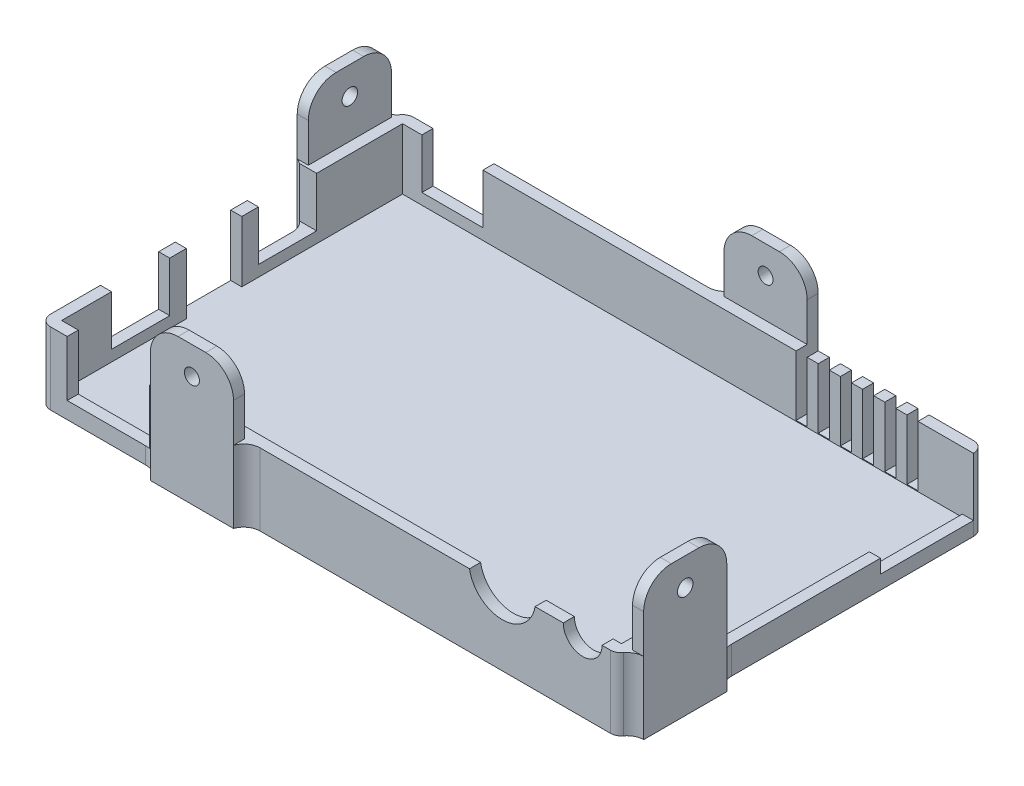
from build123d import *

# Parameters (mm, degrees)
SKETCH_1_W          = 105
SKETCH_1_H          = 65.5
EXTRUDE_1_DEPTH     = 13
SHELL_1_T           = -2
SKETCH_2_R          = 3.5
SKETCH_2_R_2        = 6
SKETCH_2_W          = 15
SKETCH_2_H          = 10
CUT_EXTRUDE_1_DEPTH = 15
SKETCH_3_W          = 10.5
SKETCH_3_H          = 9
SKETCH_3_W_2        = 10
SKETCH_3_H_2        = 11
CUT_EXTRUDE_2_DEPTH = 15
CUT_EXTRUDE_3_DEPTH = 15
FILLET_1_R          = 2
SKETCH_5_W          = 2
SKETCH_5_H          = 17.199999525
CUT_EXTRUDE_4_DEPTH = 15
SKETCH_6_W          = 11
SKETCH_6_H          = 9
CUT_EXTRUDE_5_DEPTH = 15
SKETCH_10_W         = 2
SKETCH_10_H         = 15
SKETCH_10_W_2       = 15
SKETCH_10_H_2       = 2
EXTRUDE_2_DEPTH     = 25
FILLET_2_R          = 3
FILLET_3_R          = 5
SKETCH_11_R         = 1.4
CUT_EXTRUDE_6_DEPTH = 120
SKETCH_13_R         = 1.35
CUT_EXTRUDE_7_DEPTH = 76


with BuildPart() as part:
    # 草图1 → 凸台-拉伸1 (new body)
    with BuildSketch(Plane(origin=(0, 0, 0), x_dir=(1, 0, 0), z_dir=(0, 1, 0))):
        with Locations((0, 0.25)):
            Rectangle(SKETCH_1_W, SKETCH_1_H)
    extrude(amount=EXTRUDE_1_DEPTH)

    # 抽壳1
    shell_1_openings = [part.faces().sort_by_distance(p)[0] for p in [
        (0, 13, -0.25),
    ]]
    offset(amount=SHELL_1_T, openings=shell_1_openings, kind=Kind.INTERSECTION)

    # 草图2 → 切除-拉伸1 (cut)
    with BuildSketch(Plane.XY.offset(32.5)):
        with Locations((45.5, 13)):
            Circle(SKETCH_2_R)
        with Locations((31, 14)):
            Circle(SKETCH_2_R_2)
        with Locations((-40, 8)):
            Rectangle(SKETCH_2_W, SKETCH_2_H)
    extrude(amount=-CUT_EXTRUDE_1_DEPTH, mode=Mode.SUBTRACT)

    # 草图3 → 切除-拉伸2 (cut)
    with BuildSketch(Plane.ZY.offset(52.5)):
        with Locations((16.25, 8.5)):
            Rectangle(SKETCH_3_W, SKETCH_3_H)
        with Locations((-10.25, 8.5)):
            Rectangle(SKETCH_3_W, SKETCH_3_H)
        with Locations((3, 7.5)):
            Rectangle(SKETCH_3_W_2, SKETCH_3_H_2)
    extrude(amount=-CUT_EXTRUDE_2_DEPTH, mode=Mode.SUBTRACT)

    # 草图4 → 切除-拉伸3 (cut)
    with BuildSketch(Plane(origin=(52.5, 0, 0), x_dir=(0, 0, -1), z_dir=(1, 0, 0))):
        Polygon((31, 13), (14.225771641, 13), (12.965043457, 13), (-15.5, 13), (-15.5, 5), (12.965043457, 5), (14.225771641, 5), (14.225771641, 2.5), (31, 2.5), align=None)
    extrude(amount=-CUT_EXTRUDE_3_DEPTH, mode=Mode.SUBTRACT)

    # 圆角1
    fillet_1_edges = [part.edges().sort_by_distance(p)[0] for p in [
        (-52.5, 6.5, -33),
        (52.5, 6.5, -33),
        (52.5, 6.5, 32.5),
        (-52.5, 6.5, 32.5),
    ]]
    fillet(fillet_1_edges, radius=FILLET_1_R)

    # 草图5 → 切除-拉伸4 (cut)
    with BuildSketch(Plane(origin=(0, 0, -33), x_dir=(-1, 0, 0), z_dir=(0, 0, -1))):
        with Locations((-41.5, 10.748878275)):
            Rectangle(SKETCH_5_W, SKETCH_5_H)
        with Locations((-37.5, 10.748878275)):
            Rectangle(SKETCH_5_W, SKETCH_5_H)
        with Locations((-33.5, 10.748878275)):
            Rectangle(SKETCH_5_W, SKETCH_5_H)
        with Locations((-29.5, 10.748878275)):
            Rectangle(SKETCH_5_W, SKETCH_5_H)
        with Locations((-25.5, 10.748878275)):
            Rectangle(SKETCH_5_W, SKETCH_5_H)
        with Locations((-21.5, 10.748878275)):
            Rectangle(SKETCH_5_W, SKETCH_5_H)
    extrude(amount=-CUT_EXTRUDE_4_DEPTH, mode=Mode.SUBTRACT)

    # 草图6 → 切除-拉伸5 (cut)
    with BuildSketch(Plane(origin=(0, 0, -33), x_dir=(-1, 0, 0), z_dir=(0, 0, -1))):
        with Locations((41.5, 8.5)):
            Rectangle(SKETCH_6_W, SKETCH_6_H)
    extrude(amount=-CUT_EXTRUDE_5_DEPTH, mode=Mode.SUBTRACT)

    # 草图10 → 凸台-拉伸2 (add)
    with BuildSketch(Plane.XZ):
        with Locations((-53.5, -23.5)):
            Rectangle(SKETCH_10_W, SKETCH_10_H)
        with Locations((53.5, 23)):
            Rectangle(SKETCH_10_W, SKETCH_10_H)
        with Locations((13, -34)):
            Rectangle(SKETCH_10_W_2, SKETCH_10_H_2)
        with Locations((-23, 33.5)):
            Rectangle(SKETCH_10_W_2, SKETCH_10_H_2)
    extrude(amount=-EXTRUDE_2_DEPTH)

    # 圆角2
    # the kernel refuses this fillet: 3 mm, written as the material it adds along each edge
    with BuildSketch(Plane(origin=(52.5, 0, 30.5), x_dir=(-0.31622776601639135, 0, 0.9486832980506626), z_dir=(0, 1, 0)), Plane(origin=(-52.5, 0, -31), x_dir=(0.31622776601639135, 0, -0.9486832980506626), z_dir=(0, 1, 0))) as fillet_2_piece_1:
        with BuildLine():
            CenterArc((2.213594362, 2.846049894), FILLET_2_R, 198.434948823, 53.130102354)
            Line((-0.632455532, 1.897366596), (0, 0))
            ThreePointArc((0, 0), (0.632455532, 0.102633404), (1.264911064, 0))
        make_face()
    extrude(amount=13)
    with BuildSketch(Plane(origin=(-52.5, 0, -16), x_dir=(0, 0, 1), z_dir=(0, 1, 0))) as fillet_2_piece_2_section:
        with BuildLine():
            CenterArc((2.828427125, -3), FILLET_2_R, 90, 70.528779366)
            Line((0, -2), (0, 0))
            Line((0, 0), (2.828427125, 0))
        make_face()
    fillet_2_piece_2 = extrude(amount=20.071067812, mode=Mode.PRIVATE)
    fillet_2_piece_2 = split(fillet_2_piece_2, bisect_by=Plane(origin=(-52.5, 4, -16), z_dir=(0, -1, 0)), keep=Keep.TOP, mode=Mode.PRIVATE)
    add(fillet_2_piece_2)
    with BuildSketch(Plane(origin=(-52.5, -7.071067812, -16), x_dir=(0, 0, 1), z_dir=(0, 1, 0))) as fillet_2_piece_3_section:
        with BuildLine():
            CenterArc((2.828427125, -3), FILLET_2_R, 90, 70.528779366)
            Line((0, -2), (0, 0))
            Line((0, 0), (2.828427125, 0))
        make_face()
    fillet_2_piece_3 = extrude(amount=20.071067812, mode=Mode.PRIVATE)
    fillet_2_piece_3 = split(fillet_2_piece_3, bisect_by=Plane(origin=(-52.5, -7.071067812, -15.5), z_dir=(0, 0, -1)), keep=Keep.TOP, mode=Mode.PRIVATE)
    fillet_2_piece_3 = split(fillet_2_piece_3, bisect_by=Plane(origin=(-52.5, 4, -16), z_dir=(0, 1, 0)), keep=Keep.TOP, mode=Mode.PRIVATE)
    add(fillet_2_piece_3)
    with BuildSketch(Plane(origin=(52.5, 0, 15.5), x_dir=(0, 0, -1), z_dir=(0, 1, 0))) as fillet_2_piece_4:
        with BuildLine():
            CenterArc((2.828427125, -3), FILLET_2_R, 90, 70.528779366)
            Line((0, -2), (0, 0))
            Line((0, 0), (2.828427125, 0))
        make_face()
    extrude(amount=5)
    with BuildSketch(Plane(origin=(5.5, 0, -33), x_dir=(-1, 0, 0), z_dir=(0, 1, 0)), Plane(origin=(-15.5, 0, 32.5), x_dir=(1, 0, 0), z_dir=(0, 1, 0))) as fillet_2_piece_5:
        with BuildLine():
            CenterArc((2.828427125, -3), FILLET_2_R, 90, 70.528779366)
            Line((0, -2), (0, 0))
            Line((0, 0), (2.828427125, 0))
        make_face()
    extrude(amount=13)
    with BuildSketch(Plane(origin=(-30.5, 0, 32.5), x_dir=(-1, 0, 0), z_dir=(0, 1, 0))) as fillet_2_piece_6_section:
        with BuildLine():
            CenterArc((2.828427125, 3), FILLET_2_R, 199.471220634, 70.528779366)
            Line((0, 2), (0, 0))
            Line((0, 0), (2.828427125, 0))
        make_face()
    fillet_2_piece_6 = extrude(amount=20.071067812, mode=Mode.PRIVATE)
    fillet_2_piece_6 = split(fillet_2_piece_6, bisect_by=Plane(origin=(-30.5, 3, 32.5), z_dir=(0, -1, 0)), keep=Keep.TOP, mode=Mode.PRIVATE)
    add(fillet_2_piece_6)
    with BuildSketch(Plane(origin=(-30.5, -7.071067812, 32.5), x_dir=(-1, 0, 0), z_dir=(0, 1, 0))) as fillet_2_piece_7_section:
        with BuildLine():
            CenterArc((2.828427125, 3), FILLET_2_R, 199.471220634, 70.528779366)
            Line((0, 2), (0, 0))
            Line((0, 0), (2.828427125, 0))
        make_face()
    fillet_2_piece_7 = extrude(amount=20.071067812, mode=Mode.PRIVATE)
    fillet_2_piece_7 = split(fillet_2_piece_7, bisect_by=Plane(origin=(-30.5, 3, 32.5), z_dir=(0, 1, 0)), keep=Keep.TOP, mode=Mode.PRIVATE)
    fillet_2_piece_7 = split(fillet_2_piece_7, bisect_by=Plane(origin=(-32.5, -7.071067812, 32.5), z_dir=(1, 0, 0)), keep=Keep.TOP, mode=Mode.PRIVATE)
    add(fillet_2_piece_7)

    # 圆角3
    fillet_3_edges = [part.edges().sort_by_distance(p)[0] for p in [
        (-53.5, 25, -31),
        (-53.5, 25, -16),
        (53.5, 25, 30.5),
        (53.5, 25, 15.5),
        (20.5, 25, -34),
        (5.5, 25, -34),
        (-30.5, 25, 33.5),
        (-15.5, 25, 33.5),
    ]]
    fillet(fillet_3_edges, radius=FILLET_3_R)

    # 草图11 → 切除-拉伸6 (cut)
    with BuildSketch(Plane(origin=(54.5, 0, 0), x_dir=(0, 0, -1), z_dir=(1, 0, 0))):
        with Locations((-23, 20)):
            Circle(SKETCH_11_R)
        with Locations((23.5, 20)):
            Circle(SKETCH_11_R)
    extrude(amount=-CUT_EXTRUDE_6_DEPTH, mode=Mode.SUBTRACT)

    # 草图13 → 切除-拉伸7 (cut)
    with BuildSketch(Plane(origin=(0, 0, -35), x_dir=(-1, 0, 0), z_dir=(0, 0, -1))):
        with Locations((-13, 20)):
            Circle(SKETCH_13_R)
        with Locations((23, 20)):
            Circle(SKETCH_13_R)
    extrude(amount=-CUT_EXTRUDE_7_DEPTH, mode=Mode.SUBTRACT)


solid = part.part
